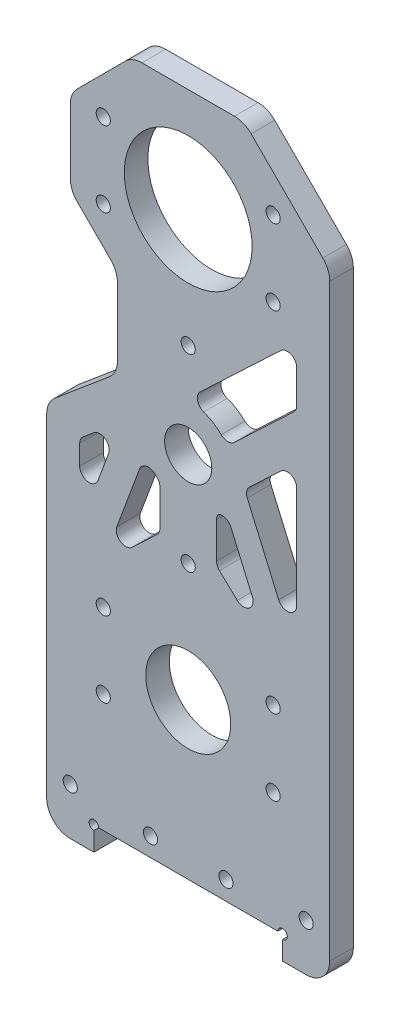
from build123d import *

# Parameters (mm, degrees)
SKETCH_1_W             = 60
SKETCH_1_H             = 150
EXTRUDE_1_DEPTH        = 5
SKETCH_2_R             = 1.5
CUT_EXTRUDE_1_DEPTH    = 5
SKETCH_4_R             = 13.55
SKETCH_4_R_2           = 9
CUT_EXTRUDE_1570_DEPTH = 154.05227865
CUT_EXTRUDE_2_DEPTH    = 154.05227865
SKETCH_6_R             = 5
CUT_EXTRUDE_3_DEPTH    = 154.05227865
SKETCH_7_R             = 1.5
CUT_EXTRUDE_4_DEPTH    = 154.05227865
SKETCH_8_R             = 4.5
CUT_EXTRUDE_5_DEPTH    = 2
CUT_EXTRUDE_6_DEPTH    = 154.05227865
FILLET_3_R             = 2
FILLET_4_R             = 5


with BuildPart() as part:
    # 草图1 → 凸台-拉伸1 (new body)
    with BuildSketch(Plane.XY):
        with Locations((0, 75)):
            Rectangle(SKETCH_1_W, SKETCH_1_H)
    extrude(amount=EXTRUDE_1_DEPTH)

    # 草图2 → 切除-拉伸1 (cut)
    with BuildSketch(Plane.XY.offset(5)):
        with BuildLine():
            Line((-20, 4), (-20, 0))
            Line((-20, 0), (20, 0))
            Line((20, 0), (20, 4))
            ThreePointArc((20, 4), (20.707106781, 5.707106781), (19, 5))
            Line((19, 5), (-19, 5))
            ThreePointArc((-19, 5), (-20.707106781, 5.707106781), (-20, 4))
        make_face()
        with Locations((-25, 10)):
            Circle(SKETCH_2_R)
        with Locations((25, 10)):
            Circle(SKETCH_2_R)
        with Locations((8, 9)):
            Circle(SKETCH_2_R)
        with Locations((-8, 9)):
            Circle(SKETCH_2_R)
    extrude(amount=-CUT_EXTRUDE_1_DEPTH, mode=Mode.SUBTRACT)

    # 草图4 → Cut-Extrude 1570 (cut, through all)
    with BuildSketch(Plane.XY.offset(5)):
        with Locations((0, 128)):
            Circle(SKETCH_4_R)
        with Locations((0, 38)):
            Circle(SKETCH_4_R_2)
    extrude(amount=-CUT_EXTRUDE_1570_DEPTH, mode=Mode.SUBTRACT)

    # 草图5 → 切除-拉伸2 (cut, through all)
    with BuildSketch(Plane.XY.offset(5)):
        Polygon((-15, 106.983208217), (-15, 90.349685577), (-30, 77.76319111), (-30, 124.859512106), (-30, 150), (-11.874342087, 150), (-22, 139.874342087), (-25, 136.874342087), (-25, 119.125657913), (-22, 116.125657913), (-15, 109.125657913), align=None)
        Polygon((11.874342087, 150), (30, 131.874342087), (30, 150), align=None)
    extrude(amount=-CUT_EXTRUDE_2_DEPTH, mode=Mode.SUBTRACT)

    # 草图6 → 切除-拉伸3 (cut, through all)
    with BuildSketch(Plane.XY.offset(5)):
        with Locations((0, 83)):
            Circle(SKETCH_6_R)
    extrude(amount=-CUT_EXTRUDE_3_DEPTH, mode=Mode.SUBTRACT)

    # 草图7 → 切除-拉伸4 (cut, through all)
    with BuildSketch(Plane.XY.offset(5)):
        with Locations((18, 136)):
            Circle(SKETCH_7_R)
        with Locations((-18, 136)):
            Circle(SKETCH_7_R)
        with Locations((-18, 120)):
            Circle(SKETCH_7_R)
        with Locations((18, 120)):
            Circle(SKETCH_7_R)
        with Locations((0, 63)):
            Circle(SKETCH_7_R)
        with Locations((0, 103)):
            Circle(SKETCH_7_R)
        with Locations((-18, 46)):
            Circle(SKETCH_7_R)
        with Locations((-18, 30)):
            Circle(SKETCH_7_R)
        with Locations((18, 46)):
            Circle(SKETCH_7_R)
        with Locations((18, 30)):
            Circle(SKETCH_7_R)
    extrude(amount=-CUT_EXTRUDE_4_DEPTH, mode=Mode.SUBTRACT)

    # 草图8 → 切除-拉伸5 (cut)
    with BuildSketch(Plane(origin=(0, 0, 0), x_dir=(-1, 0, 0), z_dir=(0, 0, -1))):
        with Locations((-18, 136)):
            Circle(SKETCH_8_R)
        with Locations((18, 136)):
            Circle(SKETCH_8_R)
        with Locations((-18, 120)):
            Circle(SKETCH_8_R)
        with Locations((18, 120)):
            Circle(SKETCH_8_R)
        with Locations((0, 103)):
            Circle(SKETCH_8_R)
        with Locations((0, 63)):
            Circle(SKETCH_8_R)
    extrude(amount=-CUT_EXTRUDE_5_DEPTH, mode=Mode.SUBTRACT)

    # 草图9 → 切除-拉伸6 (cut, through all)
    with BuildSketch(Plane.XY.offset(5)):
        Polygon((-23, 58.183667551), (-14.257978987, 81.83446411), (-23, 74.499037502), align=None)
        with BuildLine():
            ThreePointArc((-6, 75), (-7.735015794, 76.662056275), (-9.023511491, 78.689983716))
            Line((-9.023511491, 78.689983716), (-18.086264707, 54.171473379))
            Line((-18.086264707, 54.171473379), (-6, 65.586278935))
            Line((-6, 65.586278935), (-6, 75))
        make_face()
        with BuildLine():
            ThreePointArc((7.893692694, 76.860813111), (7.008875126, 75.867281761), (6, 75))
            Line((6, 75), (6, 65.586278935))
            Line((6, 65.586278935), (17.467722447, 54.75565218))
            Line((17.467722447, 54.75565218), (7.893692694, 76.860813111))
        make_face()
        Polygon((23, 92.975167824), (11.96629434, 82.554445812), (12.398973079, 81.555448171), (23, 57.079087413), align=None)
        with BuildLine():
            Line((23, 115.093785686), (-0.401978174, 92.991917411))
            ThreePointArc((-0.401978174, 92.991917411), (4.47705407, 91.941811162), (8.240956067, 88.664507313))
            Line((8.240956067, 88.664507313), (23, 102.60360436))
            Line((23, 102.60360436), (23, 115.093785686))
        make_face()
    extrude(amount=-CUT_EXTRUDE_6_DEPTH, mode=Mode.SUBTRACT)

    # 圆角3
    # the kernel refuses this fillet: 2 mm, written as the material it adds along each edge
    with BuildSketch(Plane(origin=(-9.023511491, 78.689983716, 5), x_dir=(-0.34670280320630176, -0.9379750349816846, 0), z_dir=(0, 0, -1))) as fillet_3_piece_1:
        with BuildLine():
            CenterArc((3.751460465, -2), FILLET_3_R, 90, 114.464402838)
            ThreePointArc((1.931022987, -2.82825563), (1.087482709, -1.330850611), (0, 0))
            Line((0, 0), (3.751460465, 0))
        make_face()
    extrude(amount=5)
    with BuildSketch(Plane(origin=(-6, 75, 5), x_dir=(-0.7733966621340284, 0.6339223950926041, 0), z_dir=(0, 0, -1))) as fillet_3_piece_2:
        with BuildLine():
            CenterArc((0.948198213, -1.998141534), FILLET_3_R, 92.470208625, 48.189685104)
            Line((-0.598595111, -0.730296743), (0, 0))
            ThreePointArc((0, 0), (0.430999188, -0.009292332), (0.861998376, 0))
        make_face()
    extrude(amount=5)
    with BuildSketch(Plane(origin=(-6, 65.586278935, 5), x_dir=(0, 1, 0), z_dir=(0, 0, -1)), Plane(origin=(6, 65.586278935, 5), x_dir=(0.7270131525498171, -0.6866235329637167, 0), z_dir=(0, 0, -1))) as fillet_3_piece_3:
        with BuildLine():
            CenterArc((FILLET_3_R * 0.431046489238, -FILLET_3_R), FILLET_3_R, 90, 46.636577042)
            Line((-FILLET_3_R * 0.295966663312, -FILLET_3_R * 0.313376467036), (0, 0))
            Line((0, 0), (FILLET_3_R * 0.431046489238, 0))
        make_face()
    extrude(amount=5)
    with BuildSketch(Plane(origin=(-18.086264707, 54.171473379, 5), x_dir=(0.3467028032063488, 0.9379750349816672, 0), z_dir=(0, 0, -1))) as fillet_3_piece_4:
        with BuildLine():
            CenterArc((FILLET_3_R * 4.2717705967, FILLET_3_R), FILLET_3_R, 116.350801131, 153.649198869)
            Line((FILLET_3_R * 3.82790471313, FILLET_3_R * 1.89609323031), (0, 0))
            Line((0, 0), (FILLET_3_R * 4.2717705967, 0))
        make_face()
    extrude(amount=5)
    with BuildSketch(Plane(origin=(6, 75, 5), x_dir=(0, -1, 0), z_dir=(0, 0, -1))) as fillet_3_piece_5:
        with BuildLine():
            CenterArc((0.94427191, -2), FILLET_3_R, 90, 48.189685104)
            ThreePointArc((-0.546440075, -0.666666667), (-0.266033379, -0.339223951), (0, 0))
            Line((0, 0), (0.94427191, 0))
        make_face()
    extrude(amount=5)
    with BuildSketch(Plane(origin=(7.893692694, 76.860813111, 5), x_dir=(0.39743711176533947, -0.9176294144106459, 0), z_dir=(0, 0, -1))) as fillet_3_piece_6:
        with BuildLine():
            CenterArc((2.897165869, 2), FILLET_3_R, 166.489199346, 103.510800654)
            ThreePointArc((0.952514075, 2.467257316), (0.558182396, 1.202000398), (0, 0))
            Line((0, 0), (2.897165869, 0))
        make_face()
    extrude(amount=5)
    with BuildSketch(Plane(origin=(17.467722447, 54.75565218, 5), x_dir=(-0.39743711176536367, 0.9176294144106355, 0), z_dir=(0, 0, -1))) as fillet_3_piece_7:
        with BuildLine():
            CenterArc((FILLET_3_R * 4.86762612827, -FILLET_3_R), FILLET_3_R, 90, 156.781480378)
            Line((FILLET_3_R * 4.47338714864, -FILLET_3_R * 1.91900795804), (0, 0))
            Line((0, 0), (FILLET_3_R * 4.86762612827, 0))
        make_face()
    extrude(amount=5)
    with BuildSketch(Plane(origin=(8.240956067, 88.664507313, 5), x_dir=(0.7270131525498188, 0.6866235329637153, 0), z_dir=(0, 0, -1))) as fillet_3_piece_8:
        with BuildLine():
            CenterArc((2.110522706, -2), FILLET_3_R, 90, 87.804380429)
            ThreePointArc((0.111991009, -1.923377175), (0.102424036, -0.958985229), (0, 0))
            Line((0, 0), (2.110522706, 0))
        make_face()
    extrude(amount=5)
    with BuildSketch(Plane(origin=(-0.401978174, 92.991917411, 5), x_dir=(0.9892255370424882, -0.14639957944953544, 0), z_dir=(0, 0, -1))) as fillet_3_piece_9:
        with BuildLine():
            CenterArc((4.09301108, -1.965082086), FILLET_3_R, 100.722120143, 117.496122758)
            Line((2.521691174, -3.202399246), (0, 0))
            ThreePointArc((0, 0), (1.860459582, -0.174589569), (3.720919164, 0))
        make_face()
    extrude(amount=5)
    with BuildSketch(Plane(origin=(23, 115.093785686, 5), x_dir=(-0.7270131525498174, -0.6866235329637166, 0), z_dir=(0, 0, -1))) as fillet_3_piece_10:
        with BuildLine():
            CenterArc((FILLET_3_R * 2.31993537813, -FILLET_3_R), FILLET_3_R, 90, 133.363422958)
            Line((FILLET_3_R * 1.59292222558, -FILLET_3_R * 1.68662353296), (0, 0))
            Line((0, 0), (FILLET_3_R * 2.31993537813, 0))
        make_face()
    extrude(amount=5)
    with BuildSketch(Plane(origin=(23, 102.60360436, 5), x_dir=(-0.7270131525498177, -0.6866235329637163, 0), z_dir=(0, 0, -1))) as fillet_3_piece_11:
        with BuildLine():
            CenterArc((FILLET_3_R * 0.431046489238, FILLET_3_R), FILLET_3_R, 223.363422958, 46.636577042)
            Line((-FILLET_3_R * 0.295966663312, FILLET_3_R * 0.313376467036), (0, 0))
            Line((0, 0), (FILLET_3_R * 0.431046489238, 0))
        make_face()
    extrude(amount=5)
    with BuildSketch(Plane(origin=(23, 57.079087413, 5), x_dir=(0, 1, 0), z_dir=(0, 0, -1))) as fillet_3_piece_12:
        with BuildLine():
            CenterArc((FILLET_3_R * 4.82498830039, -FILLET_3_R), FILLET_3_R, 90, 156.58194258)
            Line((FILLET_3_R * 4.42755118863, -FILLET_3_R * 1.91762941441), (0, 0))
            Line((0, 0), (FILLET_3_R * 4.82498830039, 0))
        make_face()
    extrude(amount=5)
    with BuildSketch(Plane(origin=(11.96629434, 82.554445812, 5), x_dir=(0.3974371117653669, -0.917629414410634, 0), z_dir=(0, 0, -1))) as fillet_3_piece_13:
        with BuildLine():
            CenterArc((FILLET_3_R * 0.700918309769, -FILLET_3_R), FILLET_3_R, 90, 70.054634461)
            Line((-FILLET_3_R * 0.239100017486, -FILLET_3_R * 0.658876057091), (0, 0))
            Line((0, 0), (FILLET_3_R * 0.700918309769, 0))
        make_face()
    extrude(amount=5)
    with BuildSketch(Plane(origin=(23, 92.975167824, 5), x_dir=(0, -1, 0), z_dir=(0, 0, -1))) as fillet_3_piece_14:
        with BuildLine():
            CenterArc((FILLET_3_R * 2.31993537813, FILLET_3_R), FILLET_3_R, 136.636577042, 133.363422958)
            Line((FILLET_3_R * 1.59292222558, FILLET_3_R * 1.68662353296), (0, 0))
            Line((0, 0), (FILLET_3_R * 2.31993537813, 0))
        make_face()
    extrude(amount=5)
    with BuildSketch(Plane(origin=(-14.257978987, 81.83446411, 5), x_dir=(-0.34670280320634744, -0.9379750349816677, 0), z_dir=(0, 0, -1))) as fillet_3_piece_15:
        with BuildLine():
            CenterArc((FILLET_3_R * 3.76962956743, FILLET_3_R), FILLET_3_R, 119.71422409, 150.28577591)
            Line((FILLET_3_R * 3.27395527024, FILLET_3_R * 1.86850848649), (0, 0))
            Line((0, 0), (FILLET_3_R * 3.76962956743, 0))
        make_face()
    extrude(amount=5)
    with BuildSketch(Plane(origin=(-23, 58.183667551, 5), x_dir=(0.34670280320634733, 0.9379750349816677, 0), z_dir=(0, 0, -1))) as fillet_3_piece_16:
        with BuildLine():
            CenterArc((FILLET_3_R * 5.58972992736, -FILLET_3_R), FILLET_3_R, 90, 159.71422409)
            Line((FILLET_3_R * 5.24302712415, -FILLET_3_R * 1.93797503498), (0, 0))
            Line((0, 0), (FILLET_3_R * 5.58972992736, 0))
        make_face()
    extrude(amount=5)
    with BuildSketch(Plane(origin=(-23, 74.499037502, 5), x_dir=(0, -1, 0), z_dir=(0, 0, -1))) as fillet_3_piece_17:
        with BuildLine():
            CenterArc((FILLET_3_R * 0.466307658155, -FILLET_3_R), FILLET_3_R, 90, 50)
            Line((-FILLET_3_R * 0.299736784964, -FILLET_3_R * 0.357212390313), (0, 0))
            Line((0, 0), (FILLET_3_R * 0.466307658155, 0))
        make_face()
    extrude(amount=5)

    # 圆角4
    fillet_4_edges = [part.edges().sort_by_distance(p)[0] for p in [
        (-11.874342087, 150, 2.5),
        (-25, 136.874342087, 2.5),
        (30, 0, 2.5),
        (-25, 119.125657913, 2.5),
        (-15, 109.125657913, 2.5),
        (-30, 0, 2.5),
        (-15, 90.349685577, 2.5),
        (-30, 77.76319111, 2.5),
        (11.874342087, 150, 2.5),
        (30, 131.874342087, 2.5),
    ]]
    fillet(fillet_4_edges, radius=FILLET_4_R)


solid = part.part
